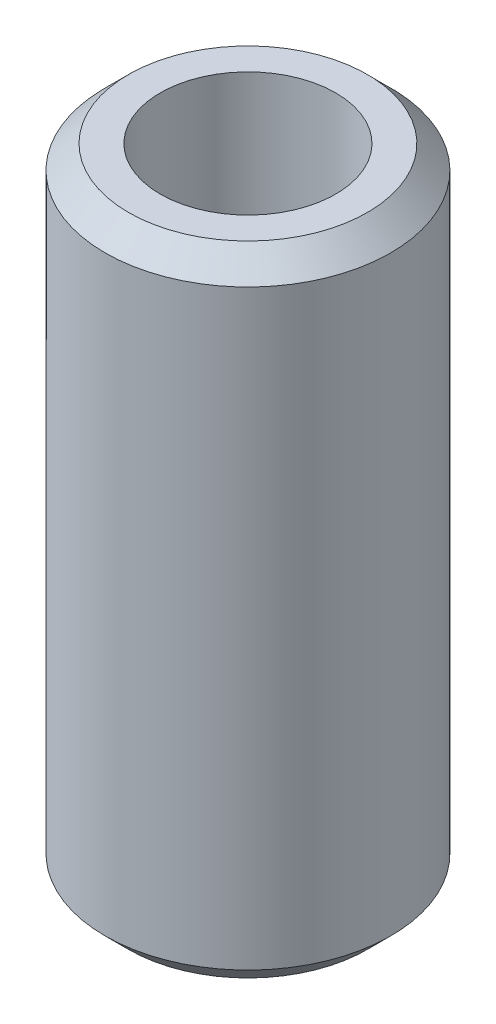
from build123d import *

# Parameters (mm, degrees)
SKETCH1_R           = 30
BOSS_EXTRUDE1_DEPTH = 134.065661058
SKETCH2_R           = 18.431554726
CUT_EXTRUDE1_DEPTH  = 141.618638433
CHAMFER1_SIZE       = 4.901998321


with BuildPart() as part:
    # Sketch1 → Boss-Extrude1 (new body)
    with BuildSketch(Plane(origin=(0, 0, 0), x_dir=(1, 0, 0), z_dir=(0, 1, 0))):
        Circle(SKETCH1_R)
    extrude(amount=BOSS_EXTRUDE1_DEPTH)

    # Sketch2 → Cut-Extrude1 (cut, through all)
    with BuildSketch(Plane(origin=(0, 0, 0), x_dir=(1, 0, 0), z_dir=(0, 1, 0))):
        Circle(SKETCH2_R)
    extrude(amount=CUT_EXTRUDE1_DEPTH, mode=Mode.SUBTRACT)

    # Chamfer1
    chamfer1_edges = [part.edges().sort_by_distance(p)[0] for p in [
        (-30, 134.065661058, 0),
        (-30, 0, 0),
    ]]
    chamfer(chamfer1_edges, length=CHAMFER1_SIZE)


solid = part.part
